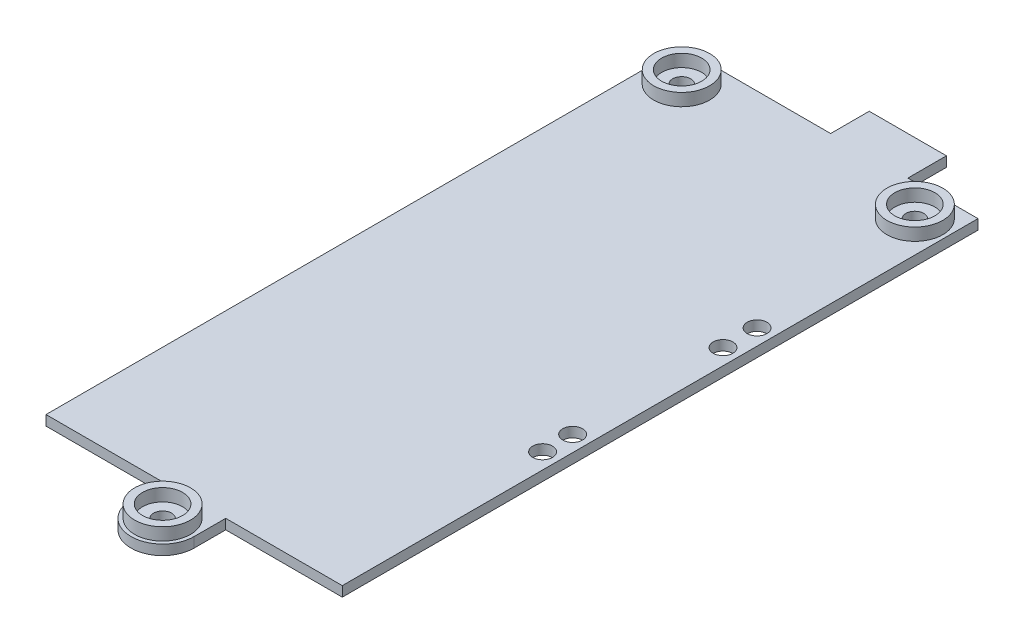
from build123d import *

# Parameters (mm, degrees)
BOSS_EXTRUDE1_DEPTH                  = 77
SKETCH3_W                            = 37.54
SKETCH3_H                            = 17.27
BOSS_EXTRUDE2_DEPTH                  = 1.77
SKETCH4_W                            = 37.54
SKETCH4_H                            = 17.27
BOSS_EXTRUDE3_DEPTH                  = 1.77
SKETCH5_W                            = 4
SKETCH5_H                            = 16
CUT_EXTRUDE2_DEPTH                   = 1.77
SKETCH6_W                            = 9.78
SKETCH6_H                            = 11.05
SKETCH6_W_2                          = 7.24
SKETCH6_H_2                          = 7.24
BUTTON_WALLS_DEPTH                   = 7.24
SKETCH7_W                            = 9.78
SKETCH7_H                            = 11.05
BUTTON_BOTTOM_DEPTH                  = 1.27
SKETCH8_W                            = 7.24
SKETCH8_H                            = 1.77
BUTTON_CUTOUT_MIDDLE_DEPTH           = 7.24
SKETCH9_W                            = 4.45
SKETCH9_H                            = 1.27
SKETCH9_W_2                          = 3.37
SKETCH9_H_2                          = 4.39
BUTTON_CUTOUT_FRONT_BACK_DEPTH       = 7.24
SKETCH10_W                           = 3.37
SKETCH10_H                           = 4.39
BUTTON_CUTOUT_BOTTOM_DEPTH           = 1.27
BUTTON_CHAMFER1_SIZE                 = 5
SKETCH12_W                           = 35
SKETCH12_H                           = 1.77
SKETCH12_W_2                         = 1.77
SKETCH12_H_2                         = 10
SKETCH12_W_3                         = 7.5
SKETCH12_R                           = 0.9652
SKETCH12_H_3                         = 7
SUPPORT_PCB_BATTERY_DEPTH            = 7
SKETCH13_R                           = 1.25
SKETCH13_W                           = 8.8
SKETCH13_H                           = 4.8
CUTOUT_USB_3_LEDS_DEPTH              = 1.77
SKETCH16_W                           = 1.77
SKETCH16_H                           = 1.77
TAB_PCB_RETAINER_LEN_DEPTH           = 3
SKETCH17_W                           = 4
SKETCH17_H                           = 1.77
CUTOUT_BACK_MOT_WIRES_DEPTH          = 9
SKETCH18_R                           = 1.25
CUTOUT_CHG_DONE_LED_DEPTH            = 10
SKETCH19_W                           = 4.2
SKETCH19_H                           = 1.77
TAB_PCB_RETAINERS_WIDTH_DEPTH        = 10
CUTOUT_RETAINER_TAB_1_DEPTH          = 1.77
CUTOUT_RETAINER_TAB_2_DEPTH          = 1.77
SKETCH23_W                           = 8
SKETCH23_H                           = 8
SKETCH23_R                           = 0.9652
CASING_SCREW_POSTS_DEPTH             = 17.27
SKETCH24_R                           = 0.9652
EXTRUDE_LID_DEPTH                    = 1.27
SKETCH25_W                           = 118.370576462
SKETCH25_H                           = 160.815259781
REMOVE_BOX_MATERIAL_DEPTH            = 17.27
SKETCH26_R                           = 1.143
THRU_HOLE_NO2_THREAD_96001A164_DEPTH = 10
SKETCH27_R                           = 3.54
SKETCH27_R_2                         = 2.54
SCREW_HEAD_RECESS_DEPTH              = 1.5748
SKETCH28_R                           = 1.25
CUTOUT_LEDS_DEPTH                    = 10


with BuildPart() as part:
    # Sketch2 → Boss-Extrude1 (new body)
    with BuildSketch(Plane.XY):
        Polygon((-30.215355805, 3.088014981), (-30.215355805, -12.911985019), (4.784644195, -12.911985019), (4.784644195, 3.088014981), (6.054644195, 3.088014981), (6.054644195, -14.181985019), (-31.485355805, -14.181985019), (-31.485355805, 3.088014981), align=None)
    extrude(amount=BOSS_EXTRUDE1_DEPTH)

    # Sketch3 → Boss-Extrude2 (add)
    with BuildSketch(Plane.XY.offset(77)):
        with Locations((-12.715355805, -5.546985019)):
            Rectangle(SKETCH3_W, SKETCH3_H)
    extrude(amount=BOSS_EXTRUDE2_DEPTH)

    # Sketch4 → Boss-Extrude3 (add)
    with BuildSketch(Plane(origin=(0, 0, 0), x_dir=(-1, 0, 0), z_dir=(0, 0, -1))):
        with Locations((12.715355805, -5.546985019)):
            Rectangle(SKETCH4_W, SKETCH4_H)
    extrude(amount=BOSS_EXTRUDE3_DEPTH)

    # Sketch5 → Cut-Extrude2 (cut)
    with BuildSketch(Plane(origin=(0, 0, -1.77), x_dir=(-1, 0, 0), z_dir=(0, 0, -1))):
        with Locations((19.215355805, -4.911985019)):
            Rectangle(SKETCH5_W, SKETCH5_H)
    extrude(amount=-CUT_EXTRUDE2_DEPTH, mode=Mode.SUBTRACT)

    # Sketch6 → button_walls (add)
    with BuildSketch(Plane(origin=(0, 3.088014981, 0), x_dir=(1, 0, 0), z_dir=(0, 1, 0))):
        with Locations((-7.725355805, 1.135)):
            Rectangle(SKETCH6_W, SKETCH6_H)
        with Locations((-7.725355805, 1.77)):
            Rectangle(SKETCH6_W_2, SKETCH6_H_2, mode=Mode.SUBTRACT)
    extrude(amount=-BUTTON_WALLS_DEPTH)

    # Sketch7 → button_bottom (add)
    with BuildSketch(Plane.XZ.offset(4.151985019)):
        with Locations((-7.725355805, -1.135)):
            Rectangle(SKETCH7_W, SKETCH7_H)
    extrude(amount=BUTTON_BOTTOM_DEPTH)

    # Sketch8 → button_cutout_middle (cut)
    with BuildSketch(Plane(origin=(0, 3.088014981, 0), x_dir=(1, 0, 0), z_dir=(0, 1, 0))):
        with Locations((-7.725355805, 0.885)):
            Rectangle(SKETCH8_W, SKETCH8_H)
    extrude(amount=-BUTTON_CUTOUT_MIDDLE_DEPTH, mode=Mode.SUBTRACT)

    # Sketch9 → button_cutout_front_back (cut)
    with BuildSketch(Plane(origin=(0, 3.088014981, 0), x_dir=(1, 0, 0), z_dir=(0, 1, 0))):
        with Locations((-7.720355805, 6.025)):
            Rectangle(SKETCH9_W, SKETCH9_H)
        with Locations((-10.930355805, -2.195)):
            Rectangle(SKETCH9_W_2, SKETCH9_H_2)
        with Locations((-4.520355805, -2.195)):
            Rectangle(SKETCH9_W_2, SKETCH9_H_2)
    extrude(amount=-BUTTON_CUTOUT_FRONT_BACK_DEPTH, mode=Mode.SUBTRACT)

    # Sketch10 → button_cutout_bottom (cut)
    with BuildSketch(Plane(origin=(0, -4.151985019, 0), x_dir=(1, 0, 0), z_dir=(0, 1, 0))):
        with Locations((-10.930355805, -2.195)):
            Rectangle(SKETCH10_W, SKETCH10_H)
        with Locations((-4.520355805, -2.195)):
            Rectangle(SKETCH10_W, SKETCH10_H)
    extrude(amount=-BUTTON_CUTOUT_BOTTOM_DEPTH, mode=Mode.SUBTRACT)

    # button_Chamfer1
    # the kernel refuses this chamfer: 5 mm, written as the material it adds along each edge
    with BuildSketch(Plane(origin=(-6.205355805, -5.421985019, 0), x_dir=(0, -0.9996219169112968, -0.027495876610586372), z_dir=(-1, 0, 0))) as button_chamfer1_piece_1_section:
        Polygon((BUTTON_CHAMFER1_SIZE * 0.999621916911, BUTTON_CHAMFER1_SIZE * 0.0274958766106), (-BUTTON_CHAMFER1_SIZE * 0.0274958766106, BUTTON_CHAMFER1_SIZE * 0.999621916911), (0, 0), align=None)
    button_chamfer1_piece_1 = extrude(amount=3.04, mode=Mode.PRIVATE)
    button_chamfer1_piece_1 = split(button_chamfer1_piece_1, bisect_by=Plane(origin=(-7.725355805, -7.110612501, 4.39), z_dir=(0, 0, -1)), keep=Keep.TOP, mode=Mode.PRIVATE)
    add(button_chamfer1_piece_1)

    # Sketch12 → support_pcb_battery (add)
    # profile 1 of 5: a face of its own
    with BuildSketch(Plane(origin=(0, -12.911985019, 0), x_dir=(1, 0, 0), z_dir=(0, 1, 0))):
        with Locations((-12.715355805, -76.115)):
            Rectangle(SKETCH12_W, SKETCH12_H)
    # profile 2 of 5: a face of its own
    with BuildSketch(Plane(origin=(0, -12.911985019, 0), x_dir=(1, 0, 0), z_dir=(0, 1, 0))):
        with Locations((-27.100355805, -60.23)):
            Rectangle(SKETCH12_W_2, SKETCH12_H_2)
    # profile 3 of 5: a face of its own
    with BuildSketch(Plane(origin=(0, -12.911985019, 0), x_dir=(1, 0, 0), z_dir=(0, 1, 0))):
        with Locations((1.034644195, -36.845)):
            Rectangle(SKETCH12_W_3, SKETCH12_H)
    # profile 4 of 5: a face of its own
    with BuildSketch(Plane(origin=(0, -12.911985019, 0), x_dir=(1, 0, 0), z_dir=(0, 1, 0))):
        with BuildLine():
            Line((-25.783918863, -37.73), (-19.764792747, -37.73))
            ThreePointArc((-19.764792747, -37.73), (-22.774355805, -30.7466), (-25.783918863, -37.73))
        make_face()
        with Locations(Location((-22.774355805, -34.8868, 0), (0, 0, 270))):
            Circle(SKETCH12_R, mode=Mode.SUBTRACT)
    # profile 5 of 5: a face of its own
    with BuildSketch(Plane(origin=(0, -12.911985019, 0), x_dir=(1, 0, 0), z_dir=(0, 1, 0))):
        with Locations((-12.100355805, -23.33)):
            Rectangle(SKETCH12_W_2, SKETCH12_H_3)
    extrude(amount=SUPPORT_PCB_BATTERY_DEPTH)

    # Sketch13 → cutout_usb_3_leds (cut)
    with BuildSketch(Plane(origin=(6.054644195, 0, 0), x_dir=(0, 0, -1), z_dir=(1, 0, 0))):
        with Locations((-51.3968, -3.411985019)):
            Circle(SKETCH13_R)
        with Locations((-47.5868, -3.411985019)):
            Circle(SKETCH13_R)
        with Locations((-24.2188, -3.411985019)):
            Circle(SKETCH13_R)
        with Locations((-34.8868, -3.411985019)):
            Rectangle(SKETCH13_W, SKETCH13_H)
    extrude(amount=-CUTOUT_USB_3_LEDS_DEPTH, mode=Mode.SUBTRACT)

    # Sketch16 → tab_pcb_retainer_len (add)
    with BuildSketch(Plane(origin=(0, -5.911985019, 0), x_dir=(1, 0, 0), z_dir=(0, 1, 0))):
        with Locations((-12.100355805, -20.715)):
            Rectangle(SKETCH16_W, SKETCH16_H)
    extrude(amount=TAB_PCB_RETAINER_LEN_DEPTH)

    # Sketch17 → cutout_back_mot_wires (cut)
    with BuildSketch(Plane(origin=(0, 3.088014981, 0), x_dir=(1, 0, 0), z_dir=(0, 1, 0))):
        with Locations((-20.361355805, -77.885)):
            Rectangle(SKETCH17_W, SKETCH17_H)
    extrude(amount=-CUTOUT_BACK_MOT_WIRES_DEPTH, mode=Mode.SUBTRACT)

    # Sketch18 → cutout_chg_done_led (cut)
    with BuildSketch(Plane(origin=(6.054644195, 0, 0), x_dir=(0, 0, -1), z_dir=(1, 0, 0))):
        with Locations((-28.5368, -3.411985019)):
            Circle(SKETCH18_R)
    extrude(amount=-CUTOUT_CHG_DONE_LED_DEPTH, mode=Mode.SUBTRACT)

    # Sketch19 → tab_pcb_retainers_width (add)
    with BuildSketch(Plane(origin=(0, -12.911985019, 0), x_dir=(1, 0, 0), z_dir=(0, 1, 0))):
        with Locations((-28.115355805, -68.615)):
            Rectangle(SKETCH19_W, SKETCH19_H)
        with Locations((-28.115355805, -46.115)):
            Rectangle(SKETCH19_W, SKETCH19_H)
        with Locations((-28.115355805, -28.115)):
            Rectangle(SKETCH19_W, SKETCH19_H)
    extrude(amount=TAB_PCB_RETAINERS_WIDTH_DEPTH)

    # Sketch20 → cutout_retainer_tab_1 (cut)
    with BuildSketch(Plane.XY.offset(69.5)):
        Polygon((-26.015355805, -12.911985019), (-26.015355805, -5.911985019), (-28.445355805, -10.120868481), (-28.445355805, -12.911985019), align=None)
    extrude(amount=-CUTOUT_RETAINER_TAB_1_DEPTH, mode=Mode.SUBTRACT)

    # Sketch21 → cutout_retainer_tab_2 (cut)
    with BuildSketch(Plane.XY.offset(47)):
        Polygon((-26.015355805, -5.911985019), (-28.445355805, -10.120868481), (-28.445355805, -12.911985019), (-26.015355805, -12.911985019), align=None)
    extrude(amount=-CUTOUT_RETAINER_TAB_2_DEPTH, mode=Mode.SUBTRACT)

    # Sketch23 → casing_screw_posts (add)
    # profile 1 of 3: a face of its own
    with BuildSketch(Plane.XZ.offset(14.181985019)):
        with Locations((2.054644195, 2.23)):
            Rectangle(SKETCH23_W, SKETCH23_H)
        with Locations(Location((2.054644195, 2.23, 0), (0, 0, 270))):
            Circle(SKETCH23_R, mode=Mode.SUBTRACT)
    # profile 2 of 3: a face of its own
    with BuildSketch(Plane.XZ.offset(14.181985019)):
        with Locations((-27.485355805, 2.23)):
            Rectangle(SKETCH23_W, SKETCH23_H)
        with Locations(Location((-27.485355805, 2.23, 0), (0, 0, 270))):
            Circle(SKETCH23_R, mode=Mode.SUBTRACT)
    # profile 3 of 3: a face of its own
    with BuildSketch(Plane.XZ.offset(14.181985019)):
        with BuildLine():
            Line((-16.715355805, 82.77), (-16.715355805, 78.77))
            Line((-16.715355805, 78.77), (-8.715355805, 78.77))
            Line((-8.715355805, 78.77), (-8.715355805, 82.77))
            ThreePointArc((-8.715355805, 82.77), (-12.715355805, 86.77), (-16.715355805, 82.77))
        make_face()
        with Locations(Location((-12.715355805, 82.77, 0), (0, 0, 270))):
            Circle(SKETCH23_R, mode=Mode.SUBTRACT)
    extrude(amount=-CASING_SCREW_POSTS_DEPTH)

    # Sketch24 → extrude_lid (add)
    # profile 1 of 2: a face of its own
    with BuildSketch(Plane(origin=(0, 3.088014981, 0), x_dir=(1, 0, 0), z_dir=(0, 1, 0))):
        with BuildLine():
            Line((-8.715355805, -78.77), (6.054644195, -78.77))
            Line((6.054644195, -78.77), (6.054644195, 1.77))
            Line((6.054644195, 1.77), (-2.835355805, 1.77))
            Line((-2.835355805, 1.77), (-2.835355805, 6.66))
            Line((-2.835355805, 6.66), (-5.495355805, 6.66))
            Line((-5.495355805, 6.66), (-5.495355805, 5.39))
            Line((-5.495355805, 5.39), (-4.105355805, 5.39))
            Line((-4.105355805, 5.39), (-4.105355805, 0))
            Line((-4.105355805, 0), (-1.945355805, 0))
            Line((-1.945355805, 0), (-1.945355805, -6.23))
            Line((-1.945355805, -6.23), (4.784644195, -6.23))
            Line((4.784644195, -6.23), (4.784644195, -77))
            Line((4.784644195, -77), (-18.361355805, -77))
            Line((-18.361355805, -77), (-18.361355805, -78.77))
            Line((-18.361355805, -78.77), (-16.715355805, -78.77))
            Line((-16.715355805, -78.77), (-16.715355805, -82.77))
            ThreePointArc((-16.715355805, -82.77), (-12.715355805, -86.77), (-8.715355805, -82.77))
            Line((-8.715355805, -82.77), (-8.715355805, -78.77))
        make_face()
        with Locations(Location((-12.715355805, -82.77, 0), (0, 0, 90))):
            Circle(SKETCH24_R, mode=Mode.SUBTRACT)
        with Locations(Location((2.054644195, -2.23, 0), (0, 0, 90))):
            Circle(SKETCH24_R, mode=Mode.SUBTRACT)
    # profile 2 of 2: a face of its own
    with BuildSketch(Plane(origin=(0, 3.088014981, 0), x_dir=(1, 0, 0), z_dir=(0, 1, 0))):
        Polygon((-31.485355805, -78.77), (-18.361355805, -78.77), (-18.361355805, -77), (4.784644195, -77), (4.784644195, -6.23), (-1.945355805, -6.23), (-1.945355805, 0), (-4.105355805, 0), (-4.105355805, 5.39), (-5.495355805, 5.39), (-5.495355805, 6.66), (-12.615355805, 6.66), (-12.615355805, 1.77), (-31.485355805, 1.77), align=None)
        with Locations(Location((-27.485355805, -2.23, 0), (0, 0, 90))):
            Circle(SKETCH24_R, mode=Mode.SUBTRACT)
    extrude(amount=EXTRUDE_LID_DEPTH)

    # Sketch25 → remove_box_material (cut)
    with BuildSketch(Plane.XZ.offset(14.181985019)):
        with Locations((-13.638066312, 39.395921067)):
            Rectangle(SKETCH25_W, SKETCH25_H)
    extrude(amount=-REMOVE_BOX_MATERIAL_DEPTH, mode=Mode.SUBTRACT)

    # Sketch26 → thru_hole_no2_thread_96001A164 (cut)
    with BuildSketch(Plane(origin=(0, 4.358014981, 0), x_dir=(1, 0, 0), z_dir=(0, 1, 0))):
        with Locations(Location((-27.485355805, -2.23, 0), (0, 0, 270))):
            Circle(SKETCH26_R)
        with Locations(Location((2.054644195, -2.23, 0), (0, 0, 270))):
            Circle(SKETCH26_R)
        with Locations(Location((-12.715355805, -82.77, 0), (0, 0, 270))):
            Circle(SKETCH26_R)
    extrude(amount=-THRU_HOLE_NO2_THREAD_96001A164_DEPTH, mode=Mode.SUBTRACT)

    # Sketch27 → screw_head_recess (add)
    # profile 1 of 3: a face of its own
    with BuildSketch(Plane(origin=(0, 4.358014981, 0), x_dir=(1, 0, 0), z_dir=(0, 1, 0))):
        with Locations(Location((-12.715355805, -82.77, 0), (0, 0, 270))):
            Circle(SKETCH27_R)
        with Locations(Location((-12.715355805, -82.77, 0), (0, 0, 270))):
            Circle(SKETCH27_R_2, mode=Mode.SUBTRACT)
    # profile 2 of 3: a face of its own
    with BuildSketch(Plane(origin=(0, 4.358014981, 0), x_dir=(1, 0, 0), z_dir=(0, 1, 0))):
        with Locations(Location((-27.485355805, -2.23, 0), (0, 0, 270))):
            Circle(SKETCH27_R)
        with Locations(Location((-27.485355805, -2.23, 0), (0, 0, 270))):
            Circle(SKETCH27_R_2, mode=Mode.SUBTRACT)
    # profile 3 of 3: a face of its own
    with BuildSketch(Plane(origin=(0, 4.358014981, 0), x_dir=(1, 0, 0), z_dir=(0, 1, 0))):
        with Locations(Location((2.054644195, -2.23, 0), (0, 0, 270))):
            Circle(SKETCH27_R)
        with Locations(Location((2.054644195, -2.23, 0), (0, 0, 270))):
            Circle(SKETCH27_R_2, mode=Mode.SUBTRACT)
    extrude(amount=SCREW_HEAD_RECESS_DEPTH)

    # Sketch28 → cutout_leds (cut)
    with BuildSketch(Plane(origin=(0, 4.358014981, 0), x_dir=(1, 0, 0), z_dir=(0, 1, 0))):
        with Locations(Location((4.054644195, -51.3968, 0), (0, 0, 270))):
            Circle(SKETCH28_R)
        with Locations(Location((4.054644195, -47.5868, 0), (0, 0, 270))):
            Circle(SKETCH28_R)
        with Locations(Location((4.054644195, -28.5368, 0), (0, 0, 270))):
            Circle(SKETCH28_R)
        with Locations(Location((4.054644195, -24.2188, 0), (0, 0, 270))):
            Circle(SKETCH28_R)
    extrude(amount=-CUTOUT_LEDS_DEPTH, mode=Mode.SUBTRACT)


solid = part.part
